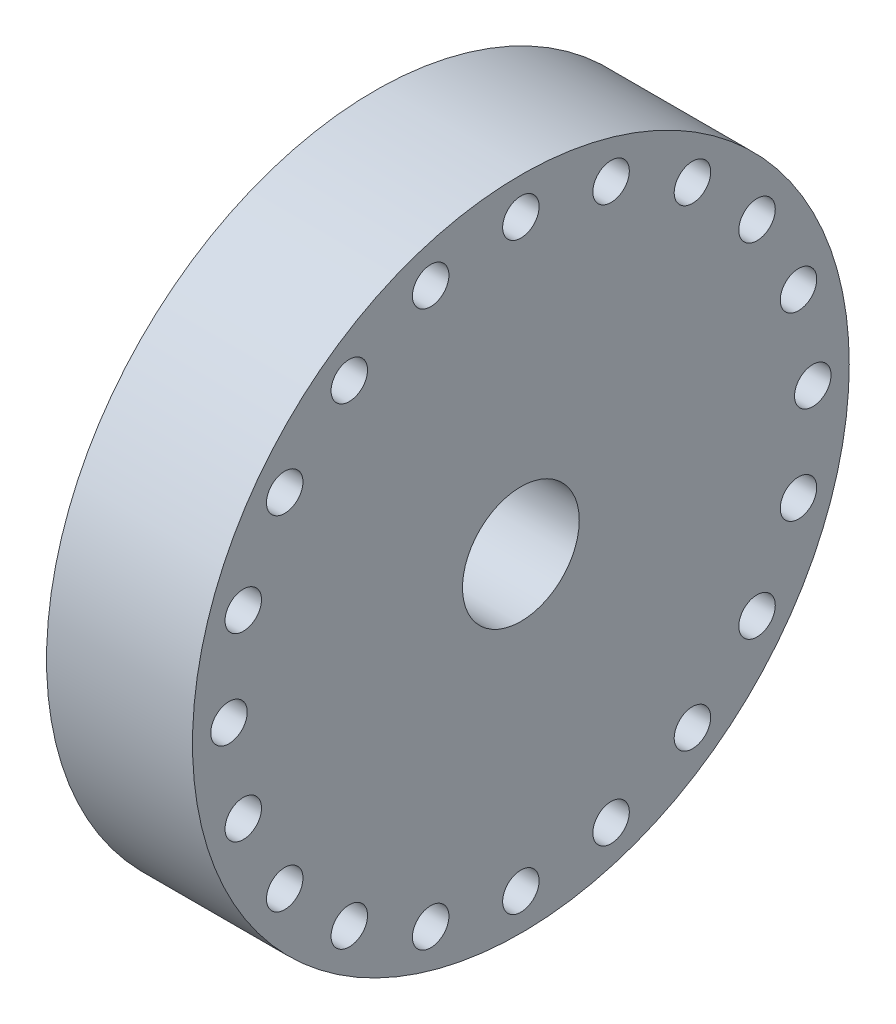
from build123d import *

# Parameters (mm, degrees)
SKETCH1_R           = 7.14375
SKETCH1_R_2         = 0.396875
BOSS_EXTRUDE1_DEPTH = 3.175
SKETCH2_R           = 1.27
CUT_EXTRUDE1_DEPTH  = 11.589945851


with BuildPart() as part:
    # Sketch1 → Boss-Extrude1 (new body)
    with BuildSketch(Plane(origin=(0, 0, 0), x_dir=(0, 0, -1), z_dir=(1, 0, 0))):
        Circle(SKETCH1_R)
        with Locations((0, 6.35)):
            Circle(SKETCH1_R_2, mode=Mode.SUBTRACT)
        with Locations((1.962257914, 6.039208878)):
            Circle(SKETCH1_R_2, mode=Mode.SUBTRACT)
        with Locations((3.732436352, 5.137257914)):
            Circle(SKETCH1_R_2, mode=Mode.SUBTRACT)
        with Locations((5.137257914, 3.732436352)):
            Circle(SKETCH1_R_2, mode=Mode.SUBTRACT)
        with Locations((6.039208878, 1.962257914)):
            Circle(SKETCH1_R_2, mode=Mode.SUBTRACT)
        with Locations((6.35, 0)):
            Circle(SKETCH1_R_2, mode=Mode.SUBTRACT)
        with Locations((6.039208878, -1.962257914)):
            Circle(SKETCH1_R_2, mode=Mode.SUBTRACT)
        with Locations((5.137257914, -3.732436352)):
            Circle(SKETCH1_R_2, mode=Mode.SUBTRACT)
        with Locations((3.732436352, -5.137257914)):
            Circle(SKETCH1_R_2, mode=Mode.SUBTRACT)
        with Locations((1.962257914, -6.039208878)):
            Circle(SKETCH1_R_2, mode=Mode.SUBTRACT)
        with Locations((0, -6.35)):
            Circle(SKETCH1_R_2, mode=Mode.SUBTRACT)
        with Locations((-1.962257914, -6.039208878)):
            Circle(SKETCH1_R_2, mode=Mode.SUBTRACT)
        with Locations((-3.732436352, -5.137257914)):
            Circle(SKETCH1_R_2, mode=Mode.SUBTRACT)
        with Locations((-5.137257914, -3.732436352)):
            Circle(SKETCH1_R_2, mode=Mode.SUBTRACT)
        with Locations((-6.039208878, -1.962257914)):
            Circle(SKETCH1_R_2, mode=Mode.SUBTRACT)
        with Locations((-6.35, 0)):
            Circle(SKETCH1_R_2, mode=Mode.SUBTRACT)
        with Locations((-6.039208878, 1.962257914)):
            Circle(SKETCH1_R_2, mode=Mode.SUBTRACT)
        with Locations((-5.137257914, 3.732436352)):
            Circle(SKETCH1_R_2, mode=Mode.SUBTRACT)
        with Locations((-3.732436352, 5.137257914)):
            Circle(SKETCH1_R_2, mode=Mode.SUBTRACT)
        with Locations((-1.962257914, 6.039208878)):
            Circle(SKETCH1_R_2, mode=Mode.SUBTRACT)
    extrude(amount=BOSS_EXTRUDE1_DEPTH)

    # Sketch2 → Cut-Extrude1 (cut, through all)
    with BuildSketch(Plane(origin=(3.175, 0, 0), x_dir=(0, 0, -1), z_dir=(1, 0, 0))):
        Circle(SKETCH2_R)
    extrude(amount=-CUT_EXTRUDE1_DEPTH, mode=Mode.SUBTRACT)


solid = part.part
